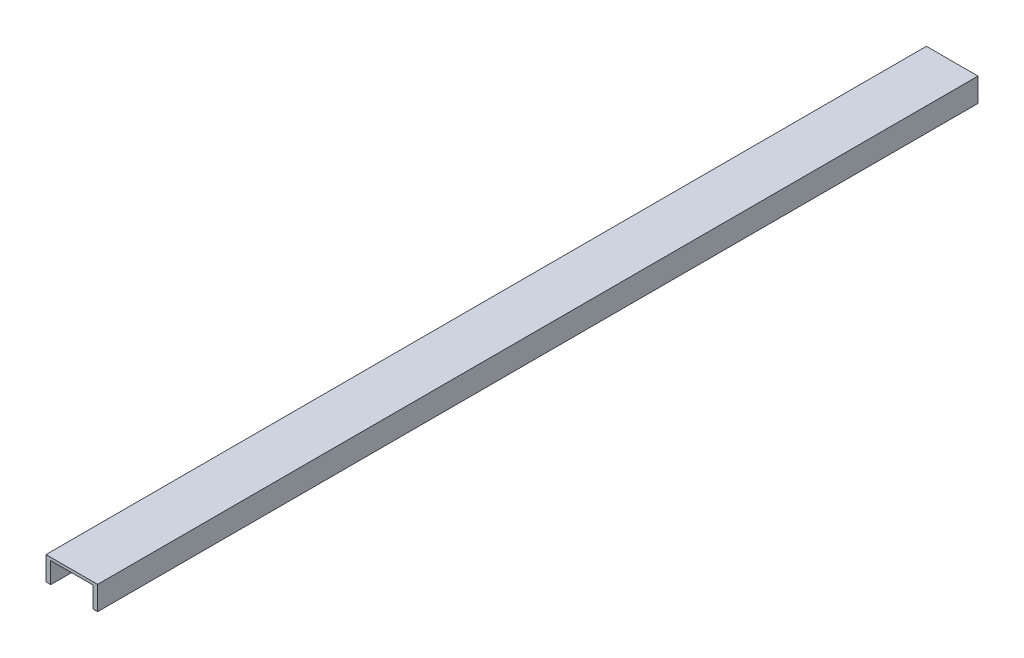
from build123d import *

# Parameters (mm, degrees)
SALIENTE_EXTRUIR1_DEPTH = 650


with BuildPart() as part:
    # Croquis2 → Saliente-Extruir1 (new, symmetric)
    with BuildSketch(Plane.XY):
        Polygon((31.1, 13.2), (31.1, -17.5), (38.1, -17.5), (38.1, 17.5), (-38.1, 17.5), (-38.1, -17.5), (-31.1, -17.5), (-31.1, 13.2), align=None)
    extrude(amount=SALIENTE_EXTRUIR1_DEPTH, both=True)


solid = part.part
